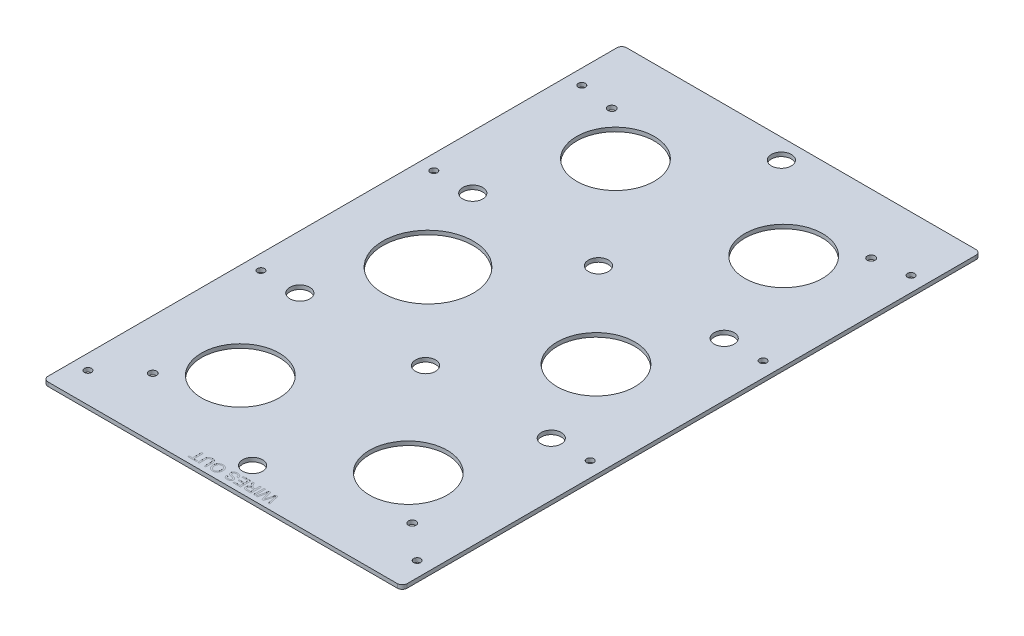
from build123d import *

# Parameters (mm, degrees)
SKETCH1_R           = 24.727
SKETCH1_R_2         = 28.76928198
SKETCH1_R_3         = 6.35
SKETCH1_R_4         = 2.45745
SKETCH1_R_5         = 2.2479
BOSS_EXTRUDE1_DEPTH = 2.54
SKETCH2_W           = 0.941716851
SKETCH2_H           = 6.677628581
CUT_EXTRUDE2_DEPTH  = 0.0254


with BuildPart() as part:
    # Sketch1 → Boss-Extrude1 (new body)
    with BuildSketch(Plane(origin=(0, 0, 0), x_dir=(1, 0, 0), z_dir=(0, 1, 0))):
        with BuildLine():
            Line((422.73608718, 215.461088922), (644.98608718, 215.461088922))
            ThreePointArc((644.98608718, 215.461088922), (647.23115121, 214.531152952), (648.16108718, 212.286088922))
            Line((648.16108718, 212.286088922), (648.16108718, -149.663911078))
            ThreePointArc((648.16108718, -149.663911078), (647.23115121, -151.908975108), (644.98608718, -152.838911078))
            Line((644.98608718, -152.838911078), (422.73608718, -152.838911078))
            ThreePointArc((422.73608718, -152.838911078), (420.49102315, -151.908975108), (419.56108718, -149.663911078))
            Line((419.56108718, -149.663911078), (419.56108718, 212.286088922))
            ThreePointArc((419.56108718, 212.286088922), (420.49102315, 214.531152952), (422.73608718, 215.461088922))
        make_face()
        with Locations((587.37888718, -88.197492761)):
            Circle(SKETCH1_R, mode=Mode.SUBTRACT)
        with Locations((587.37888718, 31.24679808)):
            Circle(SKETCH1_R, mode=Mode.SUBTRACT)
        with Locations((480.34328718, -88.068911078)):
            Circle(SKETCH1_R, mode=Mode.SUBTRACT)
        with Locations((480.34328718, 150.691088922)):
            Circle(SKETCH1_R, mode=Mode.SUBTRACT)
        with Locations((587.37888718, 150.691088922)):
            Circle(SKETCH1_R, mode=Mode.SUBTRACT)
        with Locations((480.34328718, 31.375379764)):
            Circle(SKETCH1_R_2, mode=Mode.SUBTRACT)
        with Locations((533.86108718, -133.788911078)):
            Circle(SKETCH1_R_3, mode=Mode.SUBTRACT)
        with Locations((613.87108718, -23.718011078)):
            Circle(SKETCH1_R_3, mode=Mode.SUBTRACT)
        with Locations((533.86108718, -23.722244411)):
            Circle(SKETCH1_R_3, mode=Mode.SUBTRACT)
        with Locations((453.85108718, -23.718011078)):
            Circle(SKETCH1_R_3, mode=Mode.SUBTRACT)
        with Locations((613.87108718, 86.340188922)):
            Circle(SKETCH1_R_3, mode=Mode.SUBTRACT)
        with Locations((533.86108718, 86.344422256)):
            Circle(SKETCH1_R_3, mode=Mode.SUBTRACT)
        with Locations((453.85108718, 86.340188922)):
            Circle(SKETCH1_R_3, mode=Mode.SUBTRACT)
        with Locations((533.86108718, 202.761088922)):
            Circle(SKETCH1_R_3, mode=Mode.SUBTRACT)
        with Locations((616.41108718, 177.361088922)):
            Circle(SKETCH1_R_4, mode=Mode.SUBTRACT)
        with Locations((451.31108718, 177.361088922)):
            Circle(SKETCH1_R_4, mode=Mode.SUBTRACT)
        with Locations((451.31108718, -114.738911078)):
            Circle(SKETCH1_R_4, mode=Mode.SUBTRACT)
        with Locations((616.41108718, -114.738911078)):
            Circle(SKETCH1_R_4, mode=Mode.SUBTRACT)
        with Locations((429.08608718, 180.536088922)):
            Circle(SKETCH1_R_5, mode=Mode.SUBTRACT)
        with Locations((429.08608718, 86.344422256)):
            Circle(SKETCH1_R_5, mode=Mode.SUBTRACT)
        with Locations((638.63608718, 180.536088922)):
            Circle(SKETCH1_R_5, mode=Mode.SUBTRACT)
        with Locations((638.63608718, 86.344422256)):
            Circle(SKETCH1_R_5, mode=Mode.SUBTRACT)
        with Locations((638.63608718, -23.722244411)):
            Circle(SKETCH1_R_5, mode=Mode.SUBTRACT)
        with Locations((429.08608718, -23.722244411)):
            Circle(SKETCH1_R_5, mode=Mode.SUBTRACT)
        with Locations((429.08608718, -133.788911078)):
            Circle(SKETCH1_R_5, mode=Mode.SUBTRACT)
        with Locations((638.63608718, -133.788911078)):
            Circle(SKETCH1_R_5, mode=Mode.SUBTRACT)
    extrude(amount=BOSS_EXTRUDE1_DEPTH)

    # Sketch2 → Cut-Extrude2 (cut)
    # profile 1 of 8: a face of its own
    with BuildSketch(Plane(origin=(0, 2.54, 0), x_dir=(1, 0, 0), z_dir=(0, 1, 0))):
        with BuildLine():
            Line((558.886677394, -142.838911078), (560.568123533, -149.516539659))
            Line((560.568123533, -149.516539659), (559.595640364, -149.516539659))
            Line((559.595640364, -149.516539659), (558.604429871, -145.124982241))
            add(Edge.make_bspline(
                [(558.604429871, -145.124982241), (558.553059179, -144.898491886), (558.450842246, -144.447823457), (558.349735849, -143.996904586), (558.299442028, -143.772601933)],
                knots=[0, 0, 0, 0, 1.00513078, 2, 2, 2, 2], degree=3))
            add(Edge.make_bspline(
                [(558.299442028, -143.772601933), (558.275629481, -143.853255616), (558.230675733, -144.005515071), (558.169906977, -144.221357522), (558.114712663, -144.409738812), (558.067689941, -144.571537145), (558.029615824, -144.70697984), (557.996743064, -144.814402582), (557.974337401, -144.895909061), (557.961059765, -144.940843853), (557.95566187, -144.959111659)],
                knots=[0, 0, 0, 0, 1.633809233, 3.084334118, 4.356383392, 5.447555203, 6.357852567, 7.089694452, 7.629924063, 8, 8, 8, 8], degree=3))
            Line((557.95566187, -144.959111659), (556.636723212, -149.516539659))
            Line((556.636723212, -149.516539659), (555.503720126, -149.516539659))
            Line((555.503720126, -149.516539659), (554.549964281, -146.171037038))
            add(Edge.make_bspline(
                [(554.549964281, -146.171037038), (554.497330239, -145.964365008), (554.3935473, -145.556852491), (554.255654915, -144.949847502), (554.12838465, -144.357568576), (554.055074588, -143.965840554), (554.018910886, -143.772601933)],
                knots=[0, 0, 0, 0, 1.04154457, 2.053700482, 3.039894486, 4, 4, 4, 4], degree=3))
            add(Edge.make_bspline(
                [(554.018910886, -143.772601933), (553.996530349, -143.871123954), (553.949251761, -144.079250421), (553.876545656, -144.407719652), (553.794027297, -144.768135632), (553.737883804, -145.019280198), (553.708572378, -145.150397894)],
                knots=[0, 0, 0, 0, 0.858436457, 1.813435672, 2.858437265, 4, 4, 4, 4], degree=3))
            Line((553.708572378, -145.150397894), (552.72271255, -149.516539659))
            Line((552.72271255, -149.516539659), (551.750229381, -149.516539659))
            Line((551.750229381, -149.516539659), (553.433013186, -142.838911078))
            Line((553.433013186, -142.838911078), (554.468366656, -142.838911078))
            Line((554.468366656, -142.838911078), (555.863552275, -147.942106798))
            add(Edge.make_bspline(
                [(555.863552275, -147.942106798), (555.877561948, -147.991995279), (555.904175111, -148.086764816), (555.939058734, -148.222004158), (555.97365177, -148.340941594), (556.001167119, -148.445114197), (556.02497935, -148.53347223), (556.046066099, -148.605756997), (556.059628529, -148.663383224), (556.069436249, -148.696136257), (556.073565834, -148.709927072)],
                knots=[0, 0, 0, 0, 1.562239628, 2.967673567, 4.210417925, 5.296319877, 6.215971374, 6.969386481, 7.566055473, 8, 8, 8, 8], degree=3))
            add(Edge.make_bspline(
                [(556.073565834, -148.709927072), (556.098391452, -148.622491273), (556.145416568, -148.45686887), (556.213900941, -148.224002997), (556.27278033, -148.019663107), (556.30942193, -147.893499428), (556.326384705, -147.83509352)],
                knots=[0, 0, 0, 0, 1.197732026, 2.268764715, 3.198546125, 4, 4, 4, 4], degree=3))
            Line((556.326384705, -147.83509352), (557.772401631, -142.838911078))
            Line((557.772401631, -142.838911078), (558.886677394, -142.838911078))
        make_face()
    # profile 2 of 8: a face of its own
    with BuildSketch(Plane(origin=(0, 2.54, 0), x_dir=(1, 0, 0), z_dir=(0, 1, 0))):
        with Locations((550.594485973, -146.177725369)):
            Rectangle(SKETCH2_W, SKETCH2_H)
    # profile 3 of 8: a face of its own
    with BuildSketch(Plane(origin=(0, 2.54, 0), x_dir=(1, 0, 0), z_dir=(0, 1, 0))):
        with BuildLine():
            Line((548.582636336, -142.838911078), (548.582636336, -149.516539659))
            Line((548.582636336, -149.516539659), (545.68525182, -149.516539659))
            add(Edge.make_bspline(
                [(545.68525182, -149.516539659), (545.617026961, -149.516007624), (545.484985733, -149.514977934), (545.293503986, -149.507620013), (545.115197273, -149.491988105), (544.948941829, -149.474529175), (544.795022144, -149.448750724), (544.653364861, -149.418507951), (544.524513269, -149.382764511), (544.407486948, -149.340514282), (544.298903218, -149.29273014), (544.198282944, -149.233739651), (544.10130569, -149.169209991), (544.011837182, -149.092765866), (543.925847791, -149.010634918), (543.846937637, -148.918707702), (543.772771381, -148.81928507), (543.682595011, -148.675311263), (543.58788527, -148.482324631), (543.506310164, -148.237137079), (543.454439169, -147.980396268), (543.448839881, -147.805021348), (543.445998967, -147.716041247)],
                knots=[0, 0, 0, 0, 1.242075696, 2.40389213, 3.487198984, 4.500157661, 5.446319301, 6.326791195, 7.136300648, 7.878370406, 8.590488565, 9.292260633, 9.999224673, 10.708050372, 11.431369221, 12.162165018, 12.910600795, 13.687589445, 15.252257874, 16.810406251, 18.381693487, 20, 20, 20, 20], degree=3))
            add(Edge.make_bspline(
                [(543.445998967, -147.716041247), (543.447305672, -147.65891975), (543.449886506, -147.546100875), (543.46965566, -147.380226748), (543.505427114, -147.221741389), (543.551294445, -147.069253537), (543.614082187, -146.92493565), (543.686785818, -146.785795531), (543.776982331, -146.655821149), (543.877691574, -146.530668634), (543.994798193, -146.41598588), (544.125060466, -146.309991425), (544.272394603, -146.219030361), (544.431968311, -146.134498044), (544.607894061, -146.065075007), (544.797518726, -146.003945773), (545.002309893, -145.956813408), (545.144253701, -145.933072319), (545.217068726, -145.9208935)],
                knots=[0, 0, 0, 0, 0.982645791, 1.940792824, 2.867691729, 3.775150443, 4.675643875, 5.571354211, 6.471357401, 7.392684514, 8.331098131, 9.285922955, 10.275520706, 11.304845665, 12.388884831, 13.524255008, 14.729980297, 16, 16, 16, 16], degree=3))
            add(Edge.make_bspline(
                [(545.217068726, -145.9208935), (545.163138367, -145.894011712), (545.060864265, -145.843032807), (544.921691107, -145.758684466), (544.799769231, -145.679277721), (544.730512572, -145.619733857), (544.698054325, -145.591827668)],
                knots=[0, 0, 0, 0, 1.172551213, 2.223638478, 3.167479604, 4, 4, 4, 4], degree=3))
            add(Edge.make_bspline(
                [(544.698054325, -145.591827668), (544.634866175, -145.530075234), (544.505277683, -145.403431162), (544.32843726, -145.185718714), (544.153455771, -144.946297331), (544.048400538, -144.771826562), (543.994442019, -144.682214801)],
                knots=[0, 0, 0, 0, 0.918170575, 1.883016652, 2.912673989, 4, 4, 4, 4], degree=3))
            Line((543.994442019, -144.682214801), (542.89889358, -142.838911078))
            Line((542.89889358, -142.838911078), (543.978390027, -142.838911078))
            Line((543.978390027, -142.838911078), (544.810418268, -144.248811023))
            add(Edge.make_bspline(
                [(544.810418268, -144.248811023), (544.840335656, -144.298277829), (544.898310642, -144.394136377), (544.982023423, -144.534153326), (545.064211501, -144.662988199), (545.140069144, -144.784651638), (545.21440713, -144.895935127), (545.28104616, -145.00105024), (545.347969129, -145.094042156), (545.424811548, -145.205761361), (545.5186553, -145.326550026), (545.628164322, -145.450635117), (545.728850582, -145.553421697), (545.856083371, -145.651493758), (546.014290671, -145.741288307), (546.147681987, -145.783884438), (546.212292217, -145.804516559)],
                knots=[0, 0, 0, 0, 1.130591283, 2.190900266, 3.190104209, 4.119071823, 4.994606968, 5.807262858, 6.55236009, 7.234593472, 8.459046683, 9.540234366, 10.471327768, 11.266723835, 12.676093724, 14, 14, 14, 14], degree=3))
            add(Edge.make_bspline(
                [(546.212292217, -145.804516559), (546.239434854, -145.809411299), (546.301402308, -145.820586137), (546.406622891, -145.827884442), (546.534110535, -145.835630616), (546.626503004, -145.835404918), (546.676462312, -145.835282877)],
                knots=[0, 0, 0, 0, 0.709978628, 1.620902492, 2.713552433, 4, 4, 4, 4], degree=3))
            Line((546.676462312, -145.835282877), (547.640919485, -145.835282877))
            Line((547.640919485, -145.835282877), (547.640919485, -142.838911078))
            Line((547.640919485, -142.838911078), (548.582636336, -142.838911078))
        make_face()
        with BuildLine():
            Line((547.640919485, -146.605778482), (545.852460068, -146.605778482))
            add(Edge.make_bspline(
                [(545.852460068, -146.605778482), (545.762775885, -146.607169477), (545.595119716, -146.609769811), (545.360738685, -146.632314365), (545.160248824, -146.667554733), (544.991089166, -146.721078915), (544.848926966, -146.792758357), (544.725714655, -146.880415378), (544.622114618, -146.989164531), (544.536912535, -147.113861571), (544.470307758, -147.249755477), (544.423767716, -147.393582493), (544.392522363, -147.542584665), (544.389327576, -147.644540111), (544.387715818, -147.695976257)],
                knots=[0, 0, 0, 0, 1.546056516, 2.890207646, 4.055830773, 5.050253158, 5.937355789, 6.790906573, 7.644595853, 8.512568064, 9.38593768, 10.244184789, 11.114197691, 12, 12, 12, 12], degree=3))
            add(Edge.make_bspline(
                [(544.387715818, -147.695976257), (544.388953154, -147.733460833), (544.391376731, -147.806882105), (544.404217149, -147.914608982), (544.428647159, -148.016697619), (544.462381676, -148.113883923), (544.505094498, -148.206378898), (544.557581798, -148.293818756), (544.619572746, -148.37575689), (544.69068363, -148.452596686), (544.772303153, -148.522524001), (544.865539811, -148.582853263), (544.96964907, -148.634120912), (545.084754536, -148.674810129), (545.210492859, -148.707354943), (545.347580059, -148.729005942), (545.495389142, -148.744672537), (545.597812268, -148.74557834), (545.650472504, -148.746044053)],
                knots=[0, 0, 0, 0, 0.965235723, 1.89061323, 2.787065514, 3.661873922, 4.534873316, 5.404925039, 6.281839248, 7.175200054, 8.095223355, 9.040740021, 10.02630299, 11.075573487, 12.177989335, 13.364883635, 14.645170704, 16, 16, 16, 16], degree=3))
            Line((545.650472504, -148.746044053), (547.640919485, -148.746044053))
            Line((547.640919485, -148.746044053), (547.640919485, -146.605778482))
        make_face(mode=Mode.SUBTRACT)
    # profile 4 of 8: a face of its own
    with BuildSketch(Plane(origin=(0, 2.54, 0), x_dir=(1, 0, 0), z_dir=(0, 1, 0))):
        Polygon((541.905007756, -142.838911078), (541.905007756, -149.516539659), (537.1964235, -149.516539659), (537.1964235, -148.746044053), (540.963290904, -148.746044053), (540.963290904, -146.691389105), (537.453255368, -146.691389105), (537.453255368, -145.9208935), (540.963290904, -145.9208935), (540.963290904, -143.609406683), (537.025202254, -143.609406683), (537.025202254, -142.838911078), align=None)
    # profile 5 of 8: a face of its own
    with BuildSketch(Plane(origin=(0, 2.54, 0), x_dir=(1, 0, 0), z_dir=(0, 1, 0))):
        with BuildLine():
            Line((536.083485403, -145.150397894), (535.141768552, -145.150397894))
            add(Edge.make_bspline(
                [(535.141768552, -145.150397894), (535.13143385, -145.065831844), (535.111580329, -144.903375909), (535.055628427, -144.673323583), (534.985142131, -144.465944967), (534.892395688, -144.281452899), (534.778479023, -144.115456907), (534.635951404, -143.968454605), (534.464800334, -143.839412214), (534.269060894, -143.729072993), (534.054882364, -143.636127961), (533.824155321, -143.57092541), (533.580294788, -143.531386531), (533.413209803, -143.52636178), (533.327893481, -143.52379606)],
                knots=[0, 0, 0, 0, 1.125761249, 2.162647979, 3.12492346, 4.01623828, 4.884793378, 5.777219259, 6.711258599, 7.709587174, 8.742442187, 9.791331093, 10.872217593, 12, 12, 12, 12], degree=3))
            add(Edge.make_bspline(
                [(533.327893481, -143.52379606), (533.252409875, -143.52519974), (533.105673101, -143.527928431), (532.892558932, -143.56049425), (532.6925899, -143.60867252), (532.507926362, -143.677963939), (532.342279474, -143.765063904), (532.19524669, -143.864518239), (532.073298553, -143.983042155), (531.974654654, -144.114041031), (531.898101466, -144.253150197), (531.844731272, -144.396662621), (531.808798962, -144.541783675), (531.804893255, -144.640095913), (531.802954262, -144.688903131)],
                knots=[0, 0, 0, 0, 1.267544124, 2.464049433, 3.614542348, 4.719673496, 5.768837234, 6.754183997, 7.692231426, 8.612479311, 9.501217876, 10.350240008, 11.180974857, 12, 12, 12, 12], degree=3))
            add(Edge.make_bspline(
                [(531.802954262, -144.688903131), (531.804999938, -144.737231481), (531.809002317, -144.831786208), (531.840752335, -144.968660842), (531.892057216, -145.096018864), (531.964025369, -145.214946747), (532.061836486, -145.324725318), (532.188318016, -145.422175985), (532.339946589, -145.514867252), (532.454107536, -145.564299624), (532.514592564, -145.590490002)],
                knots=[0, 0, 0, 0, 0.942081658, 1.843188798, 2.725198023, 3.611401405, 4.541884661, 5.575766242, 6.715586633, 8, 8, 8, 8], degree=3))
            add(Edge.make_bspline(
                [(532.514592564, -145.590490002), (532.538118136, -145.600144256), (532.591266678, -145.621954969), (532.68236167, -145.65082561), (532.790452794, -145.688174698), (532.917751689, -145.726440127), (533.064390252, -145.767439808), (533.229023386, -145.814623884), (533.412957186, -145.863758672), (533.609750151, -145.915775065), (533.808948517, -145.968534701), (533.999231979, -146.022480414), (534.175381569, -146.073645466), (534.336726778, -146.126231572), (534.483422117, -146.178132311), (534.615868361, -146.229012304), (534.734301116, -146.277605417), (534.806633565, -146.313342085), (534.840793706, -146.33021929)],
                knots=[0, 0, 0, 0, 0.499208779, 1.12780332, 1.87546358, 2.745246929, 3.737578632, 4.865834649, 6.108484299, 7.476352792, 8.863398792, 10.155242256, 11.360521946, 12.465428895, 13.487415091, 14.415997097, 15.251929613, 16, 16, 16, 16], degree=3))
            add(Edge.make_bspline(
                [(534.840793706, -146.33021929), (534.919337065, -146.372728755), (535.07094619, -146.454783084), (535.275785582, -146.600625351), (535.445484995, -146.765615264), (535.585430242, -146.943384174), (535.693477149, -147.13485335), (535.769814398, -147.337925687), (535.819390263, -147.551808904), (535.824205473, -147.698820101), (535.826653535, -147.773560884)],
                knots=[0, 0, 0, 0, 1.158956011, 2.237086722, 3.252429106, 4.221720014, 5.165272549, 6.094237939, 7.031106807, 8, 8, 8, 8], degree=3))
            add(Edge.make_bspline(
                [(535.826653535, -147.773560884), (535.823479655, -147.856349046), (535.817166832, -148.021014098), (535.761028733, -148.262602453), (535.671617209, -148.495832438), (535.568622646, -148.680423084), (535.46965059, -148.820579884), (535.386469604, -148.91996029), (535.294682545, -149.012383084), (535.196296673, -149.099765857), (535.087759658, -149.178841254), (534.972322571, -149.25225428), (534.847620712, -149.318040128), (534.671068883, -149.398245304), (534.43624052, -149.480476734), (534.140571601, -149.55172128), (533.829368104, -149.593427053), (533.616954584, -149.599201409), (533.508478388, -149.602150281)],
                knots=[0, 0, 0, 0, 1.200056028, 2.386902731, 3.579012093, 4.815906327, 5.442508847, 6.067203999, 6.694073756, 7.331409728, 7.974631341, 8.640655778, 9.315145047, 10.018831381, 11.453504181, 12.917815188, 14.425977399, 16, 16, 16, 16], degree=3))
            add(Edge.make_bspline(
                [(533.508478388, -149.602150281), (533.389725812, -149.599515114), (533.158933869, -149.594393748), (532.823346318, -149.54922783), (532.509408854, -149.476449439), (532.263657362, -149.390705881), (532.081495062, -149.305477823), (531.953094223, -149.236798514), (531.833503199, -149.15939628), (531.720439879, -149.077441688), (531.617944915, -148.985596336), (531.521785157, -148.888690521), (531.433578328, -148.7848562), (531.328830197, -148.636554819), (531.218185315, -148.438222395), (531.118263203, -148.183839595), (531.054276807, -147.913363396), (531.039808699, -147.727518361), (531.032458656, -147.633105956)],
                knots=[0, 0, 0, 0, 1.607451709, 3.124032445, 4.575401297, 5.965664223, 6.638286369, 7.297495781, 7.935629741, 8.566004073, 9.186263309, 9.796807256, 10.413736732, 11.028594479, 12.253110936, 13.478624344, 14.719098735, 16, 16, 16, 16], degree=3))
            Line((531.032458656, -147.633105956), (531.974175507, -147.633105956))
            add(Edge.make_bspline(
                [(531.974175507, -147.633105956), (531.979962553, -147.680969796), (531.991297733, -147.77472147), (532.023097162, -147.909458987), (532.061133888, -148.036014668), (532.109501968, -148.152966146), (532.167227909, -148.261347583), (532.235700443, -148.359922836), (532.312209515, -148.450557542), (532.398601006, -148.531661115), (532.495692272, -148.602886782), (532.603503647, -148.66444356), (532.721635399, -148.7170562), (532.851233404, -148.757616394), (532.990564785, -148.79129841), (533.141232526, -148.815476199), (533.302709905, -148.828000887), (533.413930899, -148.830415294), (533.471023741, -148.831654676)],
                knots=[0, 0, 0, 0, 1.074256797, 2.104164074, 3.082231143, 4.018364317, 4.921387537, 5.814946689, 6.689553043, 7.561782592, 8.450683137, 9.368204304, 10.325224224, 11.328240899, 12.391723181, 13.519579538, 14.726730929, 16, 16, 16, 16], degree=3))
            add(Edge.make_bspline(
                [(533.471023741, -148.831654676), (533.530369928, -148.831213249), (533.64524955, -148.830358755), (533.811286493, -148.814495465), (533.965305884, -148.79311136), (534.106358266, -148.760285978), (534.235759867, -148.721666158), (534.351240931, -148.669806937), (534.455553858, -148.611347747), (534.546796257, -148.542823708), (534.625440145, -148.466854893), (534.696024064, -148.388817941), (534.752936661, -148.304630312), (534.803051133, -148.218953692), (534.837968789, -148.127231331), (534.865378359, -148.033453781), (534.882044881, -147.935560229), (534.883959429, -147.869045199), (534.884936684, -147.83509352)],
                knots=[0, 0, 0, 0, 1.464224776, 2.834379057, 4.11387117, 5.299348816, 6.406355048, 7.441191667, 8.417293255, 9.352838038, 10.248153785, 11.113750317, 11.944205591, 12.75240885, 13.557683963, 14.358962649, 15.162355132, 16, 16, 16, 16], degree=3))
            add(Edge.make_bspline(
                [(534.884936684, -147.83509352), (534.882503066, -147.777642138), (534.877779637, -147.666134305), (534.82954653, -147.507715286), (534.755363673, -147.363306086), (534.682281739, -147.284733778), (534.645494473, -147.245182822)],
                knots=[0, 0, 0, 0, 1.050964922, 2.039826012, 3.013306874, 4, 4, 4, 4], degree=3))
            add(Edge.make_bspline(
                [(534.645494473, -147.245182822), (534.622304174, -147.225417142), (534.571020258, -147.181706563), (534.475598606, -147.123860815), (534.357290026, -147.065414613), (534.215303354, -147.007316669), (534.049885852, -146.948849914), (533.861290938, -146.888694811), (533.648443767, -146.828641027), (533.418392713, -146.771708106), (533.186312706, -146.713251181), (532.966066124, -146.655650942), (532.763062357, -146.601822493), (532.579638808, -146.545782342), (532.412777282, -146.496627283), (532.265785429, -146.444727132), (532.136022445, -146.397628353), (532.056556436, -146.364383816), (532.019656151, -146.348946614)],
                knots=[0, 0, 0, 0, 0.523895407, 1.158562347, 1.913798076, 2.79478753, 3.797549825, 4.933675542, 6.202127117, 7.604032848, 9.013379355, 10.32225155, 11.523321485, 12.628397413, 13.623935419, 14.51727859, 15.311493772, 16, 16, 16, 16], degree=3))
            add(Edge.make_bspline(
                [(532.019656151, -146.348946614), (531.971635032, -146.326822324), (531.877377624, -146.283396051), (531.74400494, -146.209037643), (531.61874514, -146.132483422), (531.50549873, -146.048124735), (531.398701003, -145.963653215), (531.30379913, -145.872332315), (531.218751715, -145.776310851), (531.118009281, -145.644380859), (531.014670659, -145.466309028), (530.925884155, -145.236163571), (530.870345902, -144.990272403), (530.864311147, -144.820735522), (530.861237411, -144.734383774)],
                knots=[0, 0, 0, 0, 0.899363591, 1.76530001, 2.59691609, 3.395188894, 4.166615117, 4.912545108, 5.632755751, 6.347510175, 7.734752518, 9.118421309, 10.532299558, 12, 12, 12, 12], degree=3))
            add(Edge.make_bspline(
                [(530.861237411, -144.734383774), (530.864777426, -144.647127142), (530.871823206, -144.473458088), (530.930704438, -144.217850397), (531.025181394, -143.970678065), (531.13452931, -143.774585899), (531.238305909, -143.624585042), (531.325454683, -143.516762357), (531.422105316, -143.417066285), (531.525869373, -143.322369915), (531.63755531, -143.234607908), (531.758102483, -143.15374365), (531.886244796, -143.078960579), (532.069203376, -142.987730916), (532.312492664, -142.892992766), (532.62144211, -142.810820741), (532.948227337, -142.762129873), (533.172112676, -142.756284852), (533.286425835, -142.753300455)],
                knots=[0, 0, 0, 0, 1.196987384, 2.382393894, 3.582009067, 4.820735309, 5.454243406, 6.085350439, 6.72189866, 7.359035515, 8.013098289, 8.67027723, 9.350744424, 10.048966745, 11.475869723, 12.9268444, 14.430883741, 16, 16, 16, 16], degree=3))
            add(Edge.make_bspline(
                [(533.286425835, -142.753300455), (533.35912218, -142.753977439), (533.50196894, -142.755307697), (533.71140751, -142.768496322), (533.911541347, -142.792324432), (534.103171131, -142.819904767), (534.285392862, -142.86135733), (534.459252121, -142.908129269), (534.623163026, -142.966806249), (534.778930537, -143.031363773), (534.925128612, -143.107645041), (535.064826902, -143.189400674), (535.194644829, -143.28318437), (535.318428699, -143.382641324), (535.432443672, -143.493285363), (535.538008939, -143.612534511), (535.636271893, -143.74011778), (535.725490454, -143.876173097), (535.805137754, -144.019140407), (535.876840219, -144.166534782), (535.936845913, -144.319142449), (535.98629559, -144.476604641), (536.026773687, -144.638206549), (536.055635803, -144.805024634), (536.07658789, -144.976012368), (536.081172652, -145.09192604), (536.083485403, -145.150397894)],
                knots=[0, 0, 0, 0, 1.259929758, 2.475735005, 3.634725603, 4.752877801, 5.82919746, 6.871690464, 7.871395985, 8.84458164, 9.791640072, 10.727373556, 11.647336026, 12.564665335, 13.477425593, 14.397128332, 15.323044476, 16.266184727, 17.214251675, 18.157898412, 19.105082968, 20.053433368, 21.01687335, 21.990151059, 22.98614553, 24, 24, 24, 24], degree=3))
        make_face()
    # profile 6 of 8: a face of its own
    with BuildSketch(Plane(origin=(0, 2.54, 0), x_dir=(1, 0, 0), z_dir=(0, 1, 0))):
        with BuildLine():
            add(Edge.make_bspline(
                [(527.351201875, -146.089439413), (527.348865332, -146.223315191), (527.344312699, -146.484165353), (527.302276295, -146.864078739), (527.232928282, -147.221100913), (527.137532911, -147.556883394), (527.01065392, -147.868893747), (526.860105554, -148.16096868), (526.67744136, -148.42802459), (526.471042677, -148.673149268), (526.24044159, -148.889837579), (525.994932969, -149.082293084), (525.731431955, -149.242822423), (525.452378113, -149.375367077), (525.156584529, -149.477130938), (524.844882062, -149.548374922), (524.517603975, -149.59433421), (524.293901748, -149.599507081), (524.179595832, -149.602150281)],
                knots=[0, 0, 0, 0, 1.203593535, 2.345140965, 3.431924157, 4.471254512, 5.478692091, 6.45615896, 7.42038538, 8.382007041, 9.33218277, 10.260966195, 11.182476517, 12.100814648, 13.034113903, 13.98924309, 14.972556454, 16, 16, 16, 16], degree=3))
            add(Edge.make_bspline(
                [(524.179595832, -149.602150281), (524.104200851, -149.600845709), (523.954480055, -149.598255063), (523.732734051, -149.578149696), (523.516952676, -149.543241169), (523.307009465, -149.494677819), (523.102594738, -149.433580089), (522.903843443, -149.358120743), (522.71043799, -149.269844934), (522.524110066, -149.167246949), (522.346182964, -149.051797697), (522.1773829, -148.926697102), (522.020332317, -148.789436011), (521.8742733, -148.64183612), (521.738076814, -148.483973329), (521.616095411, -148.312899324), (521.501109166, -148.134017), (521.400295739, -147.943219905), (521.308906007, -147.744892358), (521.232301897, -147.538174777), (521.16446244, -147.326029717), (521.109685879, -147.107139543), (521.068854997, -146.880879739), (521.037457711, -146.648876167), (521.020503894, -146.4098394), (521.017524442, -146.248645271), (521.016015785, -146.16702404)],
                knots=[0, 0, 0, 0, 1.034176269, 2.053687022, 3.051235935, 4.030520976, 5.007759882, 5.975670013, 6.944584641, 7.921900115, 8.890679583, 9.85222947, 10.801660264, 11.7488817, 12.698942795, 13.658174729, 14.62880618, 15.613957309, 16.61577279, 17.622338666, 18.636016077, 19.670029534, 20.714984856, 21.788550191, 22.880224384, 24, 24, 24, 24], degree=3))
            add(Edge.make_bspline(
                [(521.016015785, -146.16702404), (521.017407115, -146.084058486), (521.020155928, -145.920145729), (521.038755517, -145.677996436), (521.07146006, -145.442798747), (521.114837069, -145.213851345), (521.172960936, -144.991630851), (521.24203222, -144.775500145), (521.325577838, -144.566746547), (521.41993335, -144.364866904), (521.526696525, -144.172637815), (521.644463721, -143.991403242), (521.773317597, -143.822859196), (521.911303692, -143.664935494), (522.061180774, -143.520901022), (522.221791182, -143.388611923), (522.392806474, -143.268637382), (522.5735563, -143.160269728), (522.761152897, -143.064982232), (522.953318464, -142.980774535), (523.150279632, -142.912643294), (523.349154823, -142.852213836), (523.55290543, -142.808761971), (523.759610183, -142.776383327), (523.970567767, -142.757449903), (524.112230228, -142.754690712), (524.18360883, -142.753300455)],
                knots=[0, 0, 0, 0, 1.141458971, 2.255149016, 3.338763392, 4.407145747, 5.45911027, 6.497028761, 7.526847988, 8.550472592, 9.561035647, 10.549629976, 11.521388012, 12.477647518, 13.432134385, 14.377847498, 15.337760086, 16.303574593, 17.274809663, 18.230970776, 19.187525402, 20.140611526, 21.088808525, 22.051011914, 23.017975238, 24, 24, 24, 24], degree=3))
            add(Edge.make_bspline(
                [(524.18360883, -142.753300455), (524.260346628, -142.754489343), (524.412344989, -142.756844232), (524.637240084, -142.778525154), (524.855796542, -142.815640338), (525.06926461, -142.862230098), (525.275268773, -142.927640714), (525.475532667, -143.004710539), (525.668571622, -143.09797652), (525.855377349, -143.203334425), (526.034276449, -143.320139128), (526.201475969, -143.449515058), (526.359442944, -143.586919278), (526.503366351, -143.737679006), (526.63755658, -143.897077963), (526.761562973, -144.066499456), (526.873633341, -144.246792165), (526.973146636, -144.436991664), (527.062881223, -144.632271099), (527.138525489, -144.832528558), (527.204990929, -145.034856709), (527.257926693, -145.240490921), (527.300109314, -145.448959956), (527.328474246, -145.659916096), (527.348959565, -145.873673746), (527.350450677, -146.017155589), (527.351201875, -146.089439413)],
                knots=[0, 0, 0, 0, 1.072846099, 2.125039441, 3.155166917, 4.171599398, 5.177324298, 6.174217088, 7.169783185, 8.172042761, 9.17156421, 10.154239632, 11.126115549, 12.096189878, 13.065322046, 14.038037562, 15.029377678, 16.03062832, 17.03785952, 18.032507603, 19.022297599, 20.014323703, 20.999862951, 21.994471951, 22.989647507, 24, 24, 24, 24], degree=3))
        make_face()
        with BuildLine():
            add(Edge.make_bspline(
                [(526.409485023, -146.078738086), (526.408042704, -145.982331479), (526.405230284, -145.7943454), (526.373025104, -145.520278789), (526.324216352, -145.261656512), (526.256741762, -145.017873773), (526.166654955, -144.790722679), (526.056513218, -144.579767032), (525.927314235, -144.384009739), (525.779125992, -144.20566925), (525.616299774, -144.045406413), (525.442300582, -143.905364122), (525.257290062, -143.788587709), (525.063717728, -143.6910491), (524.859017058, -143.615895959), (524.644168766, -143.562769421), (524.419177066, -143.529608328), (524.265768525, -143.52575762), (524.187621828, -143.52379606)],
                knots=[0, 0, 0, 0, 1.215616022, 2.370365452, 3.475740397, 4.533490648, 5.5560781, 6.552384115, 7.530550651, 8.509299237, 9.471863928, 10.40830403, 11.321168121, 12.226759389, 13.137923578, 14.065605683, 15.014614662, 16, 16, 16, 16], degree=3))
            add(Edge.make_bspline(
                [(524.187621828, -143.52379606), (524.108149837, -143.525785217), (523.952543903, -143.529679981), (523.724170119, -143.562281655), (523.50718944, -143.617784607), (523.29945129, -143.691671636), (523.104711044, -143.791554204), (522.918415529, -143.908516507), (522.745638474, -144.051439694), (522.582157068, -144.211990685), (522.435470442, -144.394465892), (522.305526288, -144.594466129), (522.199240548, -144.814476778), (522.110579191, -145.051333757), (522.041031685, -145.306523483), (521.992411468, -145.580043714), (521.962427776, -145.87117345), (521.959325356, -146.0710829), (521.957732636, -146.17371237)],
                knots=[0, 0, 0, 0, 0.976909331, 1.912785716, 2.828990727, 3.727421029, 4.617481149, 5.514840137, 6.426786422, 7.368873452, 8.327895072, 9.299698503, 10.295216142, 11.325792517, 12.405818789, 13.542541501, 14.738390493, 16, 16, 16, 16], degree=3))
            add(Edge.make_bspline(
                [(521.957732636, -146.17371237), (521.958301219, -146.239734433), (521.959416574, -146.369245829), (521.974187617, -146.560147103), (521.993240341, -146.745110274), (522.022248511, -146.923896579), (522.062225099, -147.095765965), (522.106513561, -147.262025647), (522.161890297, -147.42124732), (522.224738604, -147.574039322), (522.295008186, -147.719675351), (522.374467404, -147.856718093), (522.461428285, -147.985622262), (522.556791686, -148.105812428), (522.658146792, -148.218985775), (522.768720115, -148.322200101), (522.886690132, -148.417508813), (523.012071603, -148.503936883), (523.142852379, -148.581629121), (523.278368729, -148.648632477), (523.418188988, -148.705438476), (523.5621694, -148.749950669), (523.709443649, -148.786699959), (523.860366892, -148.813921415), (524.016121712, -148.828192811), (524.121158847, -148.830492434), (524.174245168, -148.831654676)],
                knots=[0, 0, 0, 0, 1.220320263, 2.393826742, 3.538159925, 4.657606474, 5.739544833, 6.799495376, 7.837090465, 8.853610905, 9.852768056, 10.824163015, 11.779900663, 12.724912201, 13.658747054, 14.586045767, 15.518168864, 16.460299482, 17.399069918, 18.328125852, 19.252745725, 20.186143833, 21.111865538, 22.057883325, 23.018444021, 24, 24, 24, 24], degree=3))
            add(Edge.make_bspline(
                [(524.174245168, -148.831654676), (524.249272808, -148.830139437), (524.397752503, -148.827140778), (524.615710996, -148.794736746), (524.826078298, -148.745953073), (525.027386802, -148.675487526), (525.221930903, -148.587023075), (525.407471799, -148.47688147), (525.585190278, -148.347372872), (525.754331081, -148.19904835), (525.911975946, -148.027930937), (526.045323022, -147.826318969), (526.157690552, -147.598879204), (526.251521406, -147.346229974), (526.323063005, -147.066402522), (526.372507659, -146.760604656), (526.403725877, -146.428513077), (526.40751623, -146.198310418), (526.409485023, -146.078738086)],
                knots=[0, 0, 0, 0, 0.895098135, 1.771399171, 2.624879489, 3.470001555, 4.31324378, 5.172350046, 6.041214072, 6.935108351, 7.854676913, 8.809932058, 9.809814619, 10.877726151, 12.02168834, 13.252153056, 14.572707754, 16, 16, 16, 16], degree=3))
        make_face(mode=Mode.SUBTRACT)
    # profile 7 of 8: a face of its own
    with BuildSketch(Plane(origin=(0, 2.54, 0), x_dir=(1, 0, 0), z_dir=(0, 1, 0))):
        with BuildLine():
            Line((515.622546547, -149.516539659), (514.680829696, -149.516539659))
            Line((514.680829696, -149.516539659), (514.680829696, -145.674762959))
            add(Edge.make_bspline(
                [(514.680829696, -145.674762959), (514.681809145, -145.593158881), (514.683715155, -145.434357212), (514.692434222, -145.202755904), (514.709582135, -144.98404963), (514.735260808, -144.778911472), (514.765949334, -144.586071265), (514.802204473, -144.406180294), (514.848405049, -144.239398968), (514.900262793, -144.083896515), (514.962014899, -143.938302785), (515.03503761, -143.800529425), (515.118962656, -143.669711261), (515.214736188, -143.546136221), (515.320836063, -143.429053782), (515.438510883, -143.319390051), (515.568288745, -143.217903754), (515.706879131, -143.120758333), (515.857931716, -143.033880326), (516.021114012, -142.958942965), (516.195378976, -142.89448562), (516.381575134, -142.842665895), (516.578847973, -142.803063948), (516.786911765, -142.773451723), (517.00628103, -142.755947825), (517.156371618, -142.75419598), (517.233096389, -142.753300455)],
                knots=[0, 0, 0, 0, 1.311377147, 2.551942077, 3.723550895, 4.835332178, 5.873100029, 6.860965504, 7.782222652, 8.65229484, 9.493385443, 10.320318369, 11.155067733, 11.987723446, 12.829729107, 13.691560723, 14.568860379, 15.475173283, 16.409214366, 17.364531151, 18.357450607, 19.391849073, 20.466818896, 21.588529868, 22.767281177, 24, 24, 24, 24], degree=3))
            add(Edge.make_bspline(
                [(517.233096389, -142.753300455), (517.308026972, -142.754403093), (517.454023366, -142.756551496), (517.667966455, -142.771088071), (517.871480077, -142.796823618), (518.065147598, -142.830677933), (518.24801519, -142.876174174), (518.419864352, -142.932779585), (518.581814939, -142.998068301), (518.734063722, -143.072611157), (518.874338092, -143.159338901), (519.006252215, -143.251962359), (519.125903817, -143.356335364), (519.23559662, -143.468525841), (519.335494431, -143.589455893), (519.423639885, -143.720278808), (519.503448846, -143.859118375), (519.569689106, -144.009562695), (519.629493335, -144.170135508), (519.679614657, -144.344213222), (519.722411945, -144.531796036), (519.756453733, -144.733317064), (519.785342182, -144.94869783), (519.802543855, -145.178723298), (519.81547033, -145.422243329), (519.816789967, -145.589132871), (519.817467066, -145.674762959)],
                knots=[0, 0, 0, 0, 1.193078897, 2.324621146, 3.412165798, 4.458033356, 5.453301711, 6.409727336, 7.336550967, 8.231923267, 9.10494906, 9.959977801, 10.795507141, 11.62892236, 12.456145611, 13.289107106, 14.138012467, 15.002334476, 15.903094886, 16.864671381, 17.884255983, 18.965082669, 20.117808422, 21.342986352, 22.636701193, 24, 24, 24, 24], degree=3))
            Line((519.817467066, -145.674762959), (519.817467066, -149.516539659))
            Line((519.817467066, -149.516539659), (518.875750214, -149.516539659))
            Line((518.875750214, -149.516539659), (518.875750214, -145.718905936))
            add(Edge.make_bspline(
                [(518.875750214, -145.718905936), (518.875134167, -145.649789935), (518.873945493, -145.51642959), (518.867760612, -145.32324046), (518.855339848, -145.143968185), (518.840174878, -144.978751914), (518.81885373, -144.827833095), (518.79205194, -144.691302271), (518.761763497, -144.568368844), (518.716601242, -144.424483335), (518.6405342, -144.264493985), (518.525320195, -144.091780168), (518.377620261, -143.946747152), (518.206489126, -143.823734386), (518.010930654, -143.727793435), (517.794387814, -143.657956185), (517.557082646, -143.616135264), (517.392006457, -143.611699706), (517.306668018, -143.609406683)],
                knots=[0, 0, 0, 0, 1.090438201, 2.104016592, 3.048763244, 3.925116223, 4.720979001, 5.45216101, 6.119252661, 6.717681473, 7.82855347, 8.901677854, 9.976092604, 11.075141713, 12.213970494, 13.397440122, 14.654570346, 16, 16, 16, 16], degree=3))
            add(Edge.make_bspline(
                [(517.306668018, -143.609406683), (517.233503731, -143.610651046), (517.092230897, -143.613053785), (516.88852427, -143.632465232), (516.701756933, -143.667770204), (516.530054235, -143.713623824), (516.374801235, -143.775108305), (516.234882896, -143.849566738), (516.113999719, -143.941064192), (516.004622415, -144.043773339), (515.912257953, -144.168806378), (515.835074381, -144.317394646), (515.768510132, -144.489660793), (515.713999725, -144.687242207), (515.674191822, -144.910377609), (515.643093006, -145.157672156), (515.626781565, -145.430199902), (515.623998857, -145.619900254), (515.622546547, -145.718905936)],
                knots=[0, 0, 0, 0, 1.111591514, 2.146370713, 3.104407205, 3.996889121, 4.842307775, 5.6365848, 6.396727704, 7.139400744, 7.909024799, 8.745519786, 9.676513234, 10.710427131, 11.854494362, 13.117490512, 14.495602074, 16, 16, 16, 16], degree=3))
            Line((515.622546547, -145.718905936), (515.622546547, -149.516539659))
        make_face()
    # profile 8 of 8: a face of its own
    with BuildSketch(Plane(origin=(0, 2.54, 0), x_dir=(1, 0, 0), z_dir=(0, 1, 0))):
        Polygon((511.513236651, -142.838911078), (511.513236651, -148.746044053), (513.653502222, -148.746044053), (513.653502222, -149.516539659), (508.431254229, -149.516539659), (508.431254229, -148.746044053), (510.5715198, -148.746044053), (510.5715198, -142.838911078), align=None)
    extrude(amount=-CUT_EXTRUDE2_DEPTH, mode=Mode.SUBTRACT)


solid = part.part
